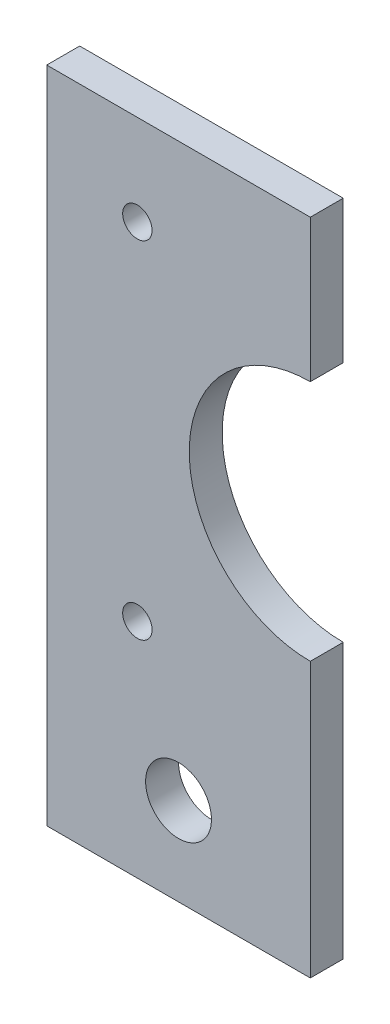
from build123d import *

# Parameters (mm, degrees)
SKETCH2_W           = 38.1
SKETCH2_H           = 95.25
BOSS_EXTRUDE1_DEPTH = 4.7625
SKETCH3_R           = 17.5
SKETCH3_R_2         = 2.125
SKETCH3_R_3         = 4.7625
CUT_EXTRUDE3_DEPTH  = 69.850663804


with BuildPart() as part:
    # Sketch2 → Boss-Extrude1 (new body)
    with BuildSketch(Plane.XY):
        with Locations((-19.05, -9.525)):
            Rectangle(SKETCH2_W, SKETCH2_H)
    extrude(amount=BOSS_EXTRUDE1_DEPTH)

    # Sketch3 → Cut-Extrude3 (cut, through all)
    with BuildSketch(Plane.XY):
        Circle(SKETCH3_R)
        with Locations((-25, 25)):
            Circle(SKETCH3_R_2)
        with Locations((25, 25)):
            Circle(SKETCH3_R_2)
        with Locations((25, -25)):
            Circle(SKETCH3_R_2)
        with Locations((-25, -25)):
            Circle(SKETCH3_R_2)
        with Locations((-19.05, -44.45)):
            Circle(SKETCH3_R_3)
    extrude(amount=CUT_EXTRUDE3_DEPTH, mode=Mode.SUBTRACT)


solid = part.part
